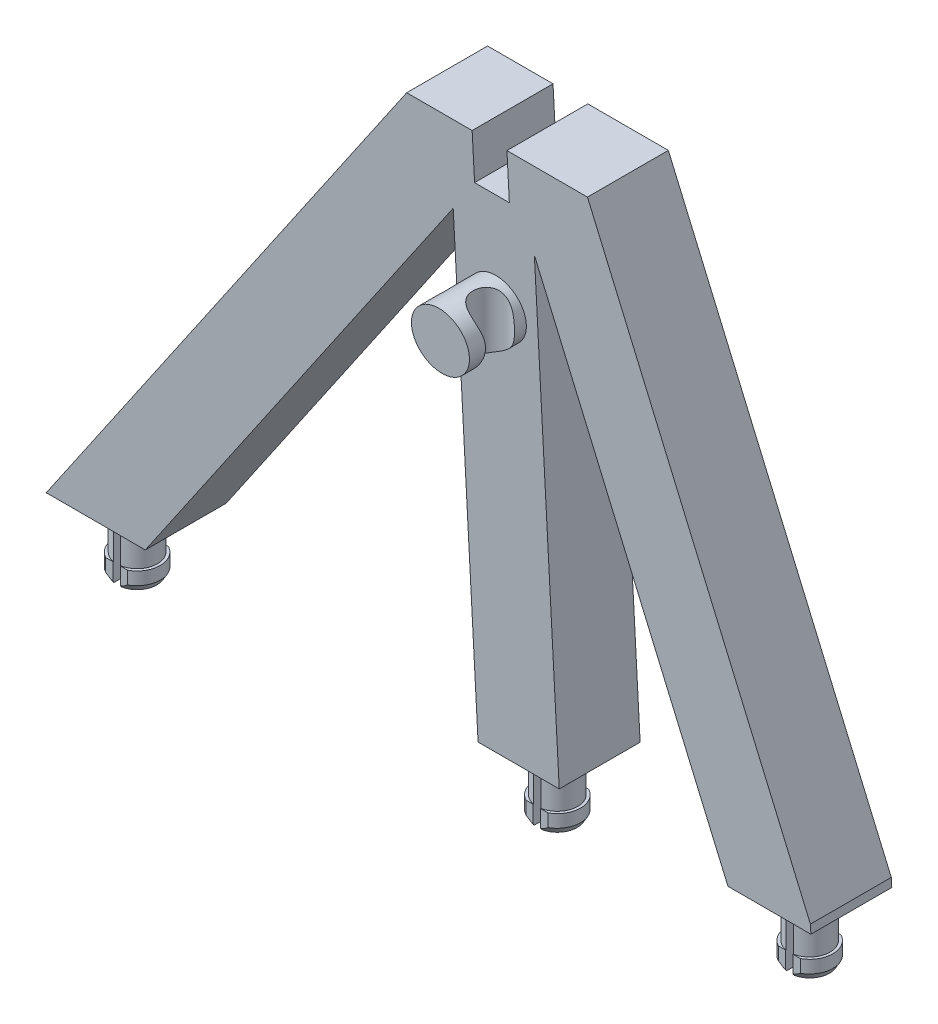
from build123d import *
from OCP.BRepFilletAPI import BRepFilletAPI_MakeChamfer

# Parameters (mm, degrees)
BOSS_EXTRUDE2_DEPTH     = 11.0744
CUT_EXTRUDE1_DEPTH      = 157.927278758
CUT_EXTRUDE1_DEPTH_BACK = 157.927278758
SKETCH3_W               = 4.7625
SKETCH3_H               = 6.35
CUT_EXTRUDE6_DEPTH      = 157.927278758
CUT_EXTRUDE6_DEPTH_BACK = 157.927278758
SKETCH12_W              = 1.27
SKETCH12_H              = 1.27
SKETCH12_W_2            = 12.7
SKETCH12_H_2            = 12.7
SKETCH13_R              = 2.794
BOSS_EXTRUDE3_DEPTH     = 6.35
SKETCH14_R              = 3.175
BOSS_EXTRUDE4_DEPTH     = 2.54
CUT_EXTRUDE7_REACH      = 163.425
SKETCH15_W              = 1.016
SKETCH15_H              = 6.35
SKETCH15_W_2            = 3.01608289
SKETCH15_H_2            = 0.381
SKETCH15_W_3            = 3.016082891
SKETCH17_R              = 3.96875
BOSS_EXTRUDE5_DEPTH     = 16.32204
SKETCH18_R              = 2.38125
CUT_EXTRUDE9_DEPTH      = 5.334
CHAMFER1_SIZE           = 0.79375
CHAMFER1_SIZE2          = 0.458271776
SKETCH19_W              = 6.0325
SKETCH19_H              = 64.754314085
BOSS_EXTRUDE6_DEPTH     = 8.542621607


with BuildPart() as part:
    # Sketch2 → Boss-Extrude2 (new, along a direction that is not the sketch's normal)
    with BuildSketch(Plane(origin=(0, 0.301230094, -5.747812595), x_dir=(1, 0, 0), z_dir=(0, -0.052335956242947394, 0.9986295347545737))):
        Polygon((-31.802314895, -0.301643486), (-58.84283214, 75.898356514), (-83.589254333, 75.898356514), (-136.927598646, -0.301643486), (-123.363202182, -0.301643486), (-77.803366414, 64.785856514), (-77.803366414, -0.301643486), (-66.690866414, -0.301643486), (-66.690866414, 64.785856514), (-43.593757934, -0.301643486), align=None)
    extrude(amount=BOSS_EXTRUDE2_DEPTH, dir=(0, 0, 1))

    # Sketch3 → Cut-Extrude1 (cut, two sides: drawn at the far end of the back side and taken through both)
    with BuildSketch(Plane.XY.offset(-CUT_EXTRUDE1_DEPTH_BACK)):
        with Locations((-72.247116414, 72.920570548)):
            Rectangle(SKETCH3_W, SKETCH3_H)
    extrude(amount=CUT_EXTRUDE1_DEPTH + CUT_EXTRUDE1_DEPTH_BACK, mode=Mode.SUBTRACT)

    # Sketch12 → Cut-Extrude6 (cut, two sides: drawn at the far end of the back side and taken through both)
    with BuildSketch(Plane.XY.offset(-CUT_EXTRUDE6_DEPTH_BACK)):
        with Locations((-31.604957934, 0.635)):
            Rectangle(SKETCH12_W, SKETCH12_H)
        with Locations((-144.150562182, 6.35)):
            Rectangle(SKETCH12_W_2, SKETCH12_H_2)
    extrude(amount=CUT_EXTRUDE6_DEPTH + CUT_EXTRUDE6_DEPTH_BACK, mode=Mode.SUBTRACT)

    # Shell13: read off the stored shape, not the designer's step
    # Shell13: loft between two sections, ruled curve by curve
    shell13_from = [
        Edge.make_line((-41.800744563, 2.54, -3.086997877), (-67.036086729, 73.555570548, 0.63477047)),
        Edge.make_line((-60.635845511, 73.555570548, 0.63477047), (-35.400503345, 2.54, -3.086997877)),
        Edge.make_line((-35.400503345, 2.54, -3.086997877), (-41.800744563, 2.54, -3.086997877)),
        Edge.make_line((-67.036086729, 73.555570548, 0.63477047), (-60.635845511, 73.555570548, 0.63477047)),
    ]
    shell13_to = [
        Edge.make_line((-41.800744563, 2.54, 5.443916364), (-67.036086729, 73.555570548, 9.165684711)),
        Edge.make_line((-60.635845511, 73.555570548, 9.165684711), (-35.400503345, 2.54, 5.443916364)),
        Edge.make_line((-35.400503345, 2.54, 5.443916364), (-41.800744563, 2.54, 5.443916364)),
        Edge.make_line((-67.036086729, 73.555570548, 9.165684711), (-60.635845511, 73.555570548, 9.165684711)),
    ]
    shell13 = Solid(Shell([*[Face.make_surface_from_curves(shell13_from[k], shell13_to[k]) for k in range(4)], Face(Wire(shell13_from)), Face(Wire(shell13_to))]))
    add(shell13, mode=Mode.SUBTRACT)

    # Shell13 2: loft between two sections, ruled curve by curve
    shell13_2_from = [
        Edge.make_line((-75.263366414, 2.54, -3.086997877), (-69.230866414, 2.54, -3.086997877)),
        Edge.make_line((-69.230866414, 67.205570548, 0.301981071), (-75.263366414, 67.205570548, 0.301981071)),
        Edge.make_line((-69.230866414, 2.54, -3.086997877), (-69.230866414, 67.205570548, 0.301981071)),
        Edge.make_line((-75.263366414, 67.205570548, 0.301981071), (-75.263366414, 2.54, -3.086997877)),
    ]
    shell13_2_to = [
        Edge.make_line((-75.263366414, 2.54, 5.443916364), (-69.230866414, 2.54, 5.443916364)),
        Edge.make_line((-69.230866414, 67.205570548, 8.832895312), (-75.263366414, 67.205570548, 8.832895312)),
        Edge.make_line((-69.230866414, 2.54, 5.443916364), (-69.230866414, 67.205570548, 8.832895312)),
        Edge.make_line((-75.263366414, 67.205570548, 8.832895312), (-75.263366414, 2.54, 5.443916364)),
    ]
    shell13_2 = Solid(Shell([*[Face.make_surface_from_curves(shell13_2_from[k], shell13_2_to[k]) for k in range(4)], Face(Wire(shell13_2_from)), Face(Wire(shell13_2_to))]))
    add(shell13_2, mode=Mode.SUBTRACT)

    # Shell13 3: loft between two sections, ruled curve by curve
    shell13_3_from = [
        Edge.make_line((-132.045380565, 2.54, -3.086997877), (-124.684650731, 2.54, -3.086997877)),
        Edge.make_line((-77.168366414, 73.555570548, 0.63477047), (-82.267805784, 73.555570548, 0.63477047)),
        Edge.make_line((-82.267805784, 73.555570548, 0.63477047), (-132.045380565, 2.54, -3.086997877)),
        Edge.make_line((-124.684650731, 2.54, -3.086997877), (-77.168366414, 70.329482632, 0.465698366)),
        Edge.make_line((-77.168366414, 70.329482632, 0.465698366), (-77.168366414, 73.555570548, 0.63477047)),
    ]
    shell13_3_to = [
        Edge.make_line((-132.045380565, 2.54, 5.443916364), (-124.684650731, 2.54, 5.443916364)),
        Edge.make_line((-77.168366414, 73.555570548, 9.165684711), (-82.267805784, 73.555570548, 9.165684711)),
        Edge.make_line((-82.267805784, 73.555570548, 9.165684711), (-132.045380565, 2.54, 5.443916364)),
        Edge.make_line((-124.684650731, 2.54, 5.443916364), (-77.168366414, 70.329482632, 8.996612607)),
        Edge.make_line((-77.168366414, 70.329482632, 8.996612607), (-77.168366414, 73.555570548, 9.165684711)),
    ]
    shell13_3 = Solid(Shell([*[Face.make_surface_from_curves(shell13_3_from[k], shell13_3_to[k]) for k in range(5)], Face(Wire(shell13_3_from)), Face(Wire(shell13_3_to))]))
    add(shell13_3, mode=Mode.SUBTRACT)

    # Sketch13 → Boss-Extrude3 (add)
    with BuildSketch(Plane.XZ):
        with Locations(Location((-130.026418646, -0.226399396, 0), (0, 0, 90))):
            Circle(SKETCH13_R)
        with Locations(Location((-72.491337934, -0.226399396, 0), (0, 0, 180))):
            Circle(SKETCH13_R)
        with Locations(Location((-37.942257934, -0.226399396, 0), (0, 0, 180))):
            Circle(SKETCH13_R)
    extrude(amount=BOSS_EXTRUDE3_DEPTH)

    # Sketch14 → Boss-Extrude4 (add)
    with BuildSketch(Plane.XZ.offset(6.35)):
        with Locations((-130.026418646, -0.226399396)):
            Circle(SKETCH14_R)
        with Locations((-72.491337934, -0.226399396)):
            Circle(SKETCH14_R)
        with Locations((-37.942257934, -0.226399396)):
            Circle(SKETCH14_R)
    extrude(amount=BOSS_EXTRUDE4_DEPTH)

    # Cut-Extrude7: up to this face of the body (flat: up to its plane)
    cut_extrude7_end = Plane(part.part.faces().sort_by_distance((-136.752488628, 0, -0.226399396))[0])
    # Sketch15 → Cut-Extrude7 (cut, up to the picked face)
    with BuildSketch(Plane.XZ.offset(8.89), mode=Mode.PRIVATE) as cut_extrude7_sk1:
        with Locations((-130.026418646, -0.226399396)):
            Rectangle(SKETCH15_W, SKETCH15_H)
    cut_extrude7_tool1 = split(extrude(cut_extrude7_sk1.sketch, amount=-CUT_EXTRUDE7_REACH, mode=Mode.PRIVATE), bisect_by=cut_extrude7_end, keep=Keep.BOTH, mode=Mode.PRIVATE)
    # Sketch15 → Cut-Extrude7 (cut, up to the picked face)
    with BuildSketch(Plane.XZ.offset(8.89), mode=Mode.PRIVATE) as cut_extrude7_sk2:
        with Locations((-72.491337934, -0.226399396)):
            Rectangle(SKETCH15_W, SKETCH15_H)
    cut_extrude7_tool2 = split(extrude(cut_extrude7_sk2.sketch, amount=-CUT_EXTRUDE7_REACH, mode=Mode.PRIVATE), bisect_by=cut_extrude7_end, keep=Keep.BOTH, mode=Mode.PRIVATE)
    # Sketch15 → Cut-Extrude7 (cut, up to the picked face)
    with BuildSketch(Plane.XZ.offset(8.89), mode=Mode.PRIVATE) as cut_extrude7_sk3:
        with Locations((-37.942257934, -0.226399396)):
            Rectangle(SKETCH15_W, SKETCH15_H)
    cut_extrude7_tool3 = split(extrude(cut_extrude7_sk3.sketch, amount=-CUT_EXTRUDE7_REACH, mode=Mode.PRIVATE), bisect_by=cut_extrude7_end, keep=Keep.BOTH, mode=Mode.PRIVATE)
    # Sketch15 → Cut-Extrude7 (cut, up to the picked face)
    with BuildSketch(Plane.XZ.offset(8.89), mode=Mode.PRIVATE) as cut_extrude7_sk4:
        with Locations((-130.026418646, 2.758100604)):
            Rectangle(SKETCH15_W_2, SKETCH15_H_2)
    cut_extrude7_tool4 = split(extrude(cut_extrude7_sk4.sketch, amount=-CUT_EXTRUDE7_REACH, mode=Mode.PRIVATE), bisect_by=cut_extrude7_end, keep=Keep.BOTH, mode=Mode.PRIVATE)
    # Sketch15 → Cut-Extrude7 (cut, up to the picked face)
    with BuildSketch(Plane.XZ.offset(8.89), mode=Mode.PRIVATE) as cut_extrude7_sk5:
        with Locations((-130.026418646, -3.210899396)):
            Rectangle(SKETCH15_W_2, SKETCH15_H_2)
    cut_extrude7_tool5 = split(extrude(cut_extrude7_sk5.sketch, amount=-CUT_EXTRUDE7_REACH, mode=Mode.PRIVATE), bisect_by=cut_extrude7_end, keep=Keep.BOTH, mode=Mode.PRIVATE)
    # Sketch15 → Cut-Extrude7 (cut, up to the picked face)
    with BuildSketch(Plane.XZ.offset(8.89), mode=Mode.PRIVATE) as cut_extrude7_sk6:
        with Locations((-72.491337934, 2.758100604)):
            Rectangle(SKETCH15_W_3, SKETCH15_H_2)
    cut_extrude7_tool6 = split(extrude(cut_extrude7_sk6.sketch, amount=-CUT_EXTRUDE7_REACH, mode=Mode.PRIVATE), bisect_by=cut_extrude7_end, keep=Keep.BOTH, mode=Mode.PRIVATE)
    # Sketch15 → Cut-Extrude7 (cut, up to the picked face)
    with BuildSketch(Plane.XZ.offset(8.89), mode=Mode.PRIVATE) as cut_extrude7_sk7:
        with Locations((-72.491337934, -3.210899396)):
            Rectangle(SKETCH15_W_3, SKETCH15_H_2)
    cut_extrude7_tool7 = split(extrude(cut_extrude7_sk7.sketch, amount=-CUT_EXTRUDE7_REACH, mode=Mode.PRIVATE), bisect_by=cut_extrude7_end, keep=Keep.BOTH, mode=Mode.PRIVATE)
    # Sketch15 → Cut-Extrude7 (cut, up to the picked face)
    with BuildSketch(Plane.XZ.offset(8.89), mode=Mode.PRIVATE) as cut_extrude7_sk8:
        with Locations((-37.942257934, -3.210899396)):
            Rectangle(SKETCH15_W_3, SKETCH15_H_2)
    cut_extrude7_tool8 = split(extrude(cut_extrude7_sk8.sketch, amount=-CUT_EXTRUDE7_REACH, mode=Mode.PRIVATE), bisect_by=cut_extrude7_end, keep=Keep.BOTH, mode=Mode.PRIVATE)
    # Sketch15 → Cut-Extrude7 (cut, up to the picked face)
    with BuildSketch(Plane.XZ.offset(8.89), mode=Mode.PRIVATE) as cut_extrude7_sk9:
        with Locations((-37.942257934, 2.758100604)):
            Rectangle(SKETCH15_W_3, SKETCH15_H_2)
    cut_extrude7_tool9 = split(extrude(cut_extrude7_sk9.sketch, amount=-CUT_EXTRUDE7_REACH, mode=Mode.PRIVATE), bisect_by=cut_extrude7_end, keep=Keep.BOTH, mode=Mode.PRIVATE)
    add(cut_extrude7_tool1.solids().sort_by(Axis((-130.026419, -8.89, -0.226399), (0, 1, 0)))[0], mode=Mode.SUBTRACT)
    add(cut_extrude7_tool2.solids().sort_by(Axis((-72.491338, -8.89, -0.226399), (0, 1, 0)))[0], mode=Mode.SUBTRACT)
    add(cut_extrude7_tool3.solids().sort_by(Axis((-37.942258, -8.89, -0.226399), (0, 1, 0)))[0], mode=Mode.SUBTRACT)
    add(cut_extrude7_tool4.solids().sort_by(Axis((-130.026419, -8.89, 2.758101), (0, 1, 0)))[0], mode=Mode.SUBTRACT)
    add(cut_extrude7_tool5.solids().sort_by(Axis((-130.026419, -8.89, -3.210899), (0, 1, 0)))[0], mode=Mode.SUBTRACT)
    add(cut_extrude7_tool6.solids().sort_by(Axis((-72.491338, -8.89, 2.758101), (0, 1, 0)))[0], mode=Mode.SUBTRACT)
    add(cut_extrude7_tool7.solids().sort_by(Axis((-72.491338, -8.89, -3.210899), (0, 1, 0)))[0], mode=Mode.SUBTRACT)
    add(cut_extrude7_tool8.solids().sort_by(Axis((-37.942258, -8.89, -3.210899), (0, 1, 0)))[0], mode=Mode.SUBTRACT)
    add(cut_extrude7_tool9.solids().sort_by(Axis((-37.942258, -8.89, 2.758101), (0, 1, 0)))[0], mode=Mode.SUBTRACT)

    # Sketch17 → Boss-Extrude5 (add, along a direction that is not the sketch's normal)
    with BuildSketch(Plane(origin=(0, 0.168296765, -3.211293577), x_dir=(-1, 0, 0), z_dir=(0, 0.05233595624294736, -0.9986295347545738))):
        with Locations((72.247116414, 55.620532118)):
            Circle(SKETCH17_R)
    extrude(amount=-BOSS_EXTRUDE5_DEPTH, dir=(0, 0, -1))

    # Sketch18 → Cut-Extrude9 (cut, symmetric)
    with BuildSketch(Plane(origin=(0, 56.273410548, 0), x_dir=(1, 0, 0), z_dir=(0, 1, 0))):
        with Locations((-69.611866414, -11.830700158)):
            Circle(SKETCH18_R)
    extrude(amount=CUT_EXTRUDE9_DEPTH, both=True, mode=Mode.SUBTRACT)

    # Chamfer1: one chamfer whose edges measure the first distance from different faces: ONE call of the kernel's chamfer builder (chamfer() names one face for all edges)
    chamfer1_edges_1 = [part.edges().sort_by_distance(p)[0] for p in [
        (-133.201418646, -8.89, -0.226399396),
    ]]
    chamfer1_side_1 = [part.faces().sort_by_distance(p)[0] for p in [
        (-133.201418646, -7.62, -0.226399396),
    ]]
    chamfer1_edges_2 = [part.edges().sort_by_distance(p)[0] for p in [
        (-126.851418646, -8.89, -0.226399396),
    ]]
    chamfer1_side_2 = [part.faces().sort_by_distance(p)[0] for p in [
        (-126.851418646, -7.62, -0.226399396),
    ]]
    chamfer1_edges_3 = [part.edges().sort_by_distance(p)[0] for p in [
        (-75.666337934, -8.89, -0.226399396),
    ]]
    chamfer1_side_3 = [part.faces().sort_by_distance(p)[0] for p in [
        (-75.666337934, -7.62, -0.226399396),
    ]]
    chamfer1_edges_4 = [part.edges().sort_by_distance(p)[0] for p in [
        (-69.316337934, -8.89, -0.226399396),
    ]]
    chamfer1_side_4 = [part.faces().sort_by_distance(p)[0] for p in [
        (-69.316337934, -7.62, -0.226399396),
    ]]
    chamfer1_edges_5 = [part.edges().sort_by_distance(p)[0] for p in [
        (-41.117257934, -8.89, -0.226399396),
    ]]
    chamfer1_side_5 = [part.faces().sort_by_distance(p)[0] for p in [
        (-41.117257934, -7.62, -0.226399396),
    ]]
    chamfer1_edges_6 = [part.edges().sort_by_distance(p)[0] for p in [
        (-34.767257934, -8.89, -0.226399396),
    ]]
    chamfer1_side_6 = [part.faces().sort_by_distance(p)[0] for p in [
        (-34.767257934, -7.62, -0.226399396),
    ]]
    chamfer1 = BRepFilletAPI_MakeChamfer(part.part.solid().wrapped)
    for e in chamfer1_edges_1:
        chamfer1.Add(CHAMFER1_SIZE, CHAMFER1_SIZE2, e.wrapped, chamfer1_side_1[0].wrapped)  # the first distance lies on this face
    for e in chamfer1_edges_2:
        chamfer1.Add(CHAMFER1_SIZE, CHAMFER1_SIZE2, e.wrapped, chamfer1_side_2[0].wrapped)  # the first distance lies on this face
    for e in chamfer1_edges_3:
        chamfer1.Add(CHAMFER1_SIZE, CHAMFER1_SIZE2, e.wrapped, chamfer1_side_3[0].wrapped)  # the first distance lies on this face
    for e in chamfer1_edges_4:
        chamfer1.Add(CHAMFER1_SIZE, CHAMFER1_SIZE2, e.wrapped, chamfer1_side_4[0].wrapped)  # the first distance lies on this face
    for e in chamfer1_edges_5:
        chamfer1.Add(CHAMFER1_SIZE, CHAMFER1_SIZE2, e.wrapped, chamfer1_side_5[0].wrapped)  # the first distance lies on this face
    for e in chamfer1_edges_6:
        chamfer1.Add(CHAMFER1_SIZE, CHAMFER1_SIZE2, e.wrapped, chamfer1_side_6[0].wrapped)  # the first distance lies on this face
    add(Compound.cast(chamfer1.Shape()), mode=Mode.REPLACE)

    # Sketch19 → Boss-Extrude6 (add, along a direction that is not the sketch's normal)
    with BuildSketch(Plane(origin=(0, -0.277564913, 5.296254044), x_dir=(1, 0, 0), z_dir=(0, -0.05233595624294739, 0.9986295347545737))):
        Polygon((-82.267805784, 73.934460069), (-77.168366414, 73.934460069), (-77.168366414, 70.703944844), (-124.684650731, 2.821431587), (-132.045380565, 2.821431587), align=None)
        with Locations((-72.247116414, 35.19858863)):
            Rectangle(SKETCH19_W, SKETCH19_H)
        Polygon((-67.036086729, 73.934460069), (-60.635845511, 73.934460069), (-35.400503345, 2.821431587), (-41.800744563, 2.821431587), align=None)
    extrude(amount=-BOSS_EXTRUDE6_DEPTH, dir=(0, 0, 1))


solid = part.part
